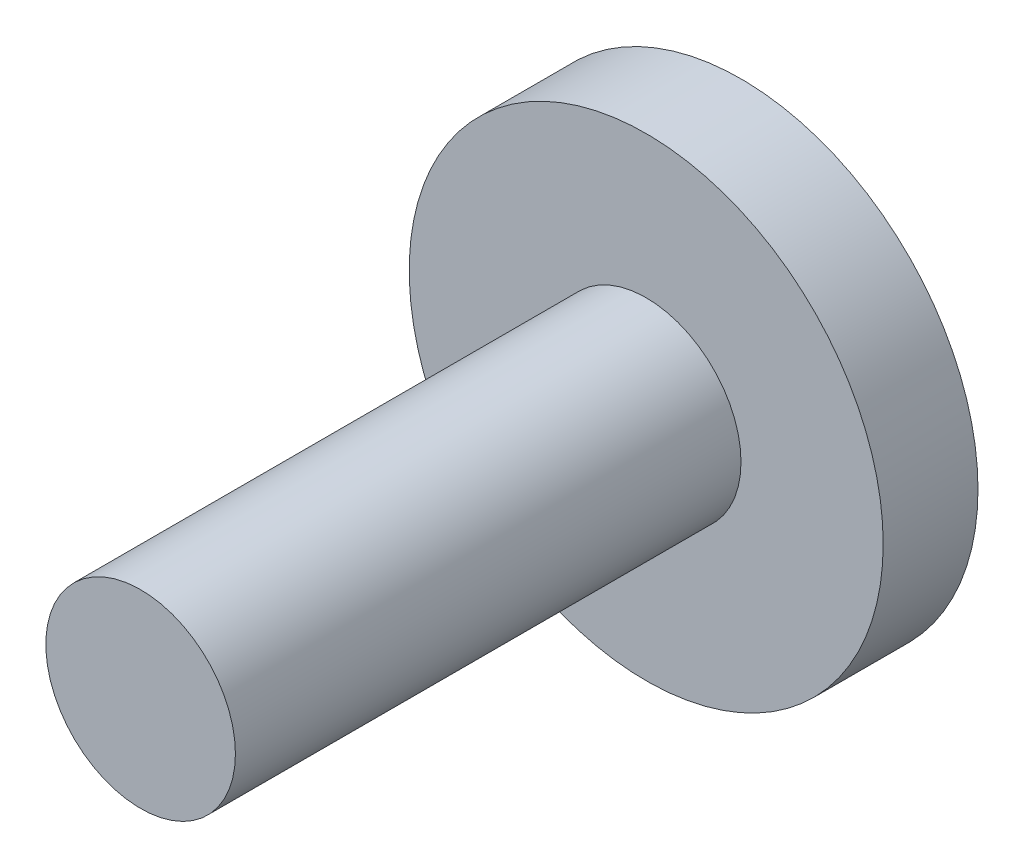
from build123d import *

# Parameters (mm, degrees)
SKETCH1_R           = 3
BOSS_EXTRUDE1_DEPTH = 19
SKETCH1_3_R         = 7.5
SKETCH1_3_R_2       = 3
BOSS_EXTRUDE2_DEPTH = 3


with BuildPart() as part:
    # Sketch1 → Boss-Extrude1 (new body)
    with BuildSketch(Plane.XY):
        Circle(SKETCH1_R)
    extrude(amount=BOSS_EXTRUDE1_DEPTH)

    # Sketch1<3> → Boss-Extrude2 (add)
    with BuildSketch(Plane.XY):
        Circle(SKETCH1_3_R)
        Circle(SKETCH1_3_R_2, mode=Mode.SUBTRACT)
    extrude(amount=BOSS_EXTRUDE2_DEPTH)


solid = part.part
